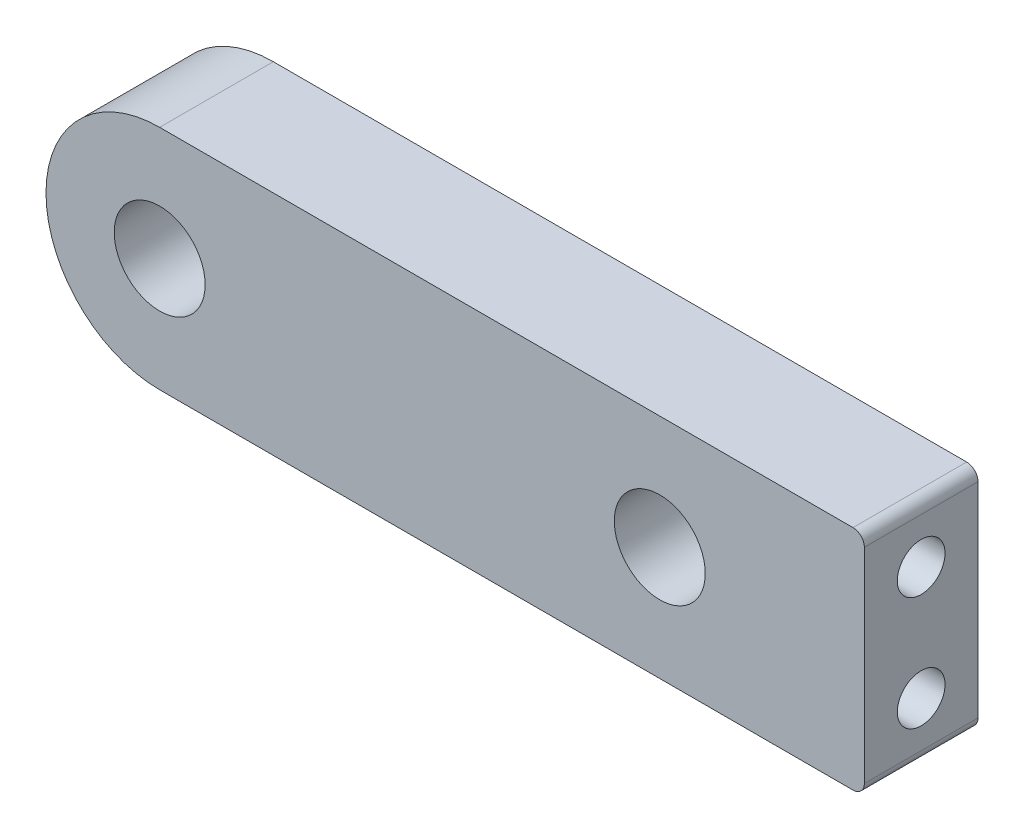
from build123d import *

# Parameters (mm, degrees)
ESQUISSE1_W               = 72
ESQUISSE1_H               = 20
ESQUISSE1_R               = 4
BOSS_EXTRU_1_DEPTH        = 10
CONG_1_R                  = 10
TROU_TARAUD_M5X0_82_D     = 4.2
TROU_TARAUD_M5X0_82_DEPTH = 14
CONG_2_R                  = 1


with BuildPart() as part:
    # Esquisse1 → Boss.-Extru.1 (new body)
    with BuildSketch(Plane.XY):
        with Locations((36, 10)):
            Rectangle(ESQUISSE1_W, ESQUISSE1_H)
        with Locations((10, 10)):
            Circle(ESQUISSE1_R, mode=Mode.SUBTRACT)
        with Locations((54, 10)):
            Circle(ESQUISSE1_R, mode=Mode.SUBTRACT)
    extrude(amount=BOSS_EXTRU_1_DEPTH)

    # Congé1
    cong_1_edges = [part.edges().sort_by_distance(p)[0] for p in [
        (0, 0, 5),
        (0, 20, 5),
    ]]
    fillet(cong_1_edges, radius=CONG_1_R - 0.0001)  # a hair under: the kernel refuses the full size

    # Trou taraudé M5x0.82
    with Locations(Plane(origin=(72, 0, 0), x_dir=(0, 0, -1), z_dir=(1, 0, 0))):
        with Locations((-5, 15), (-5, 5)):
            Hole(TROU_TARAUD_M5X0_82_D / 2, depth=TROU_TARAUD_M5X0_82_DEPTH)

    # Congé2
    cong_2_edges = [part.edges().sort_by_distance(p)[0] for p in [
        (72, 0, 5),
        (72, 20, 5),
    ]]
    fillet(cong_2_edges, radius=CONG_2_R)


solid = part.part
